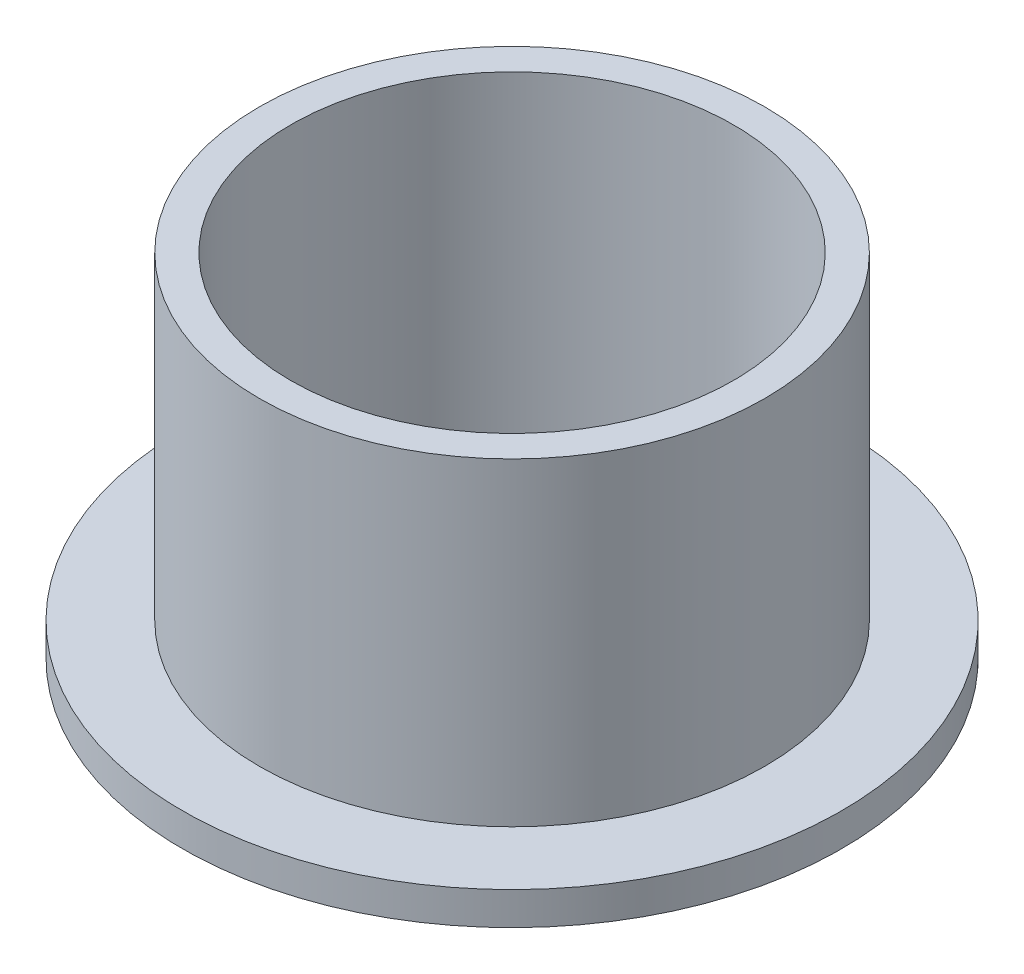
from build123d import *

# Parameters (mm, degrees)
SKETCH2_R           = 9.128125
SKETCH2_R_2         = 8.001
BOSS_EXTRUDE1_DEPTH = 12.7
SKETCH3_R           = 11.90625
SKETCH3_R_2         = 9.128125
BOSS_EXTRUDE2_DEPTH = 1.190625


with BuildPart() as part:
    # Sketch2 → Boss-Extrude1 (new body)
    with BuildSketch(Plane(origin=(0, 0, 0), x_dir=(1, 0, 0), z_dir=(0, 1, 0))):
        Circle(SKETCH2_R)
        Circle(SKETCH2_R_2, mode=Mode.SUBTRACT)
    extrude(amount=BOSS_EXTRUDE1_DEPTH)

    # Sketch3 → Boss-Extrude2 (add)
    with BuildSketch(Plane(origin=(0, 0, 0), x_dir=(1, 0, 0), z_dir=(0, 1, 0))):
        Circle(SKETCH3_R)
        Circle(SKETCH3_R_2, mode=Mode.SUBTRACT)
    extrude(amount=BOSS_EXTRUDE2_DEPTH)


solid = part.part
